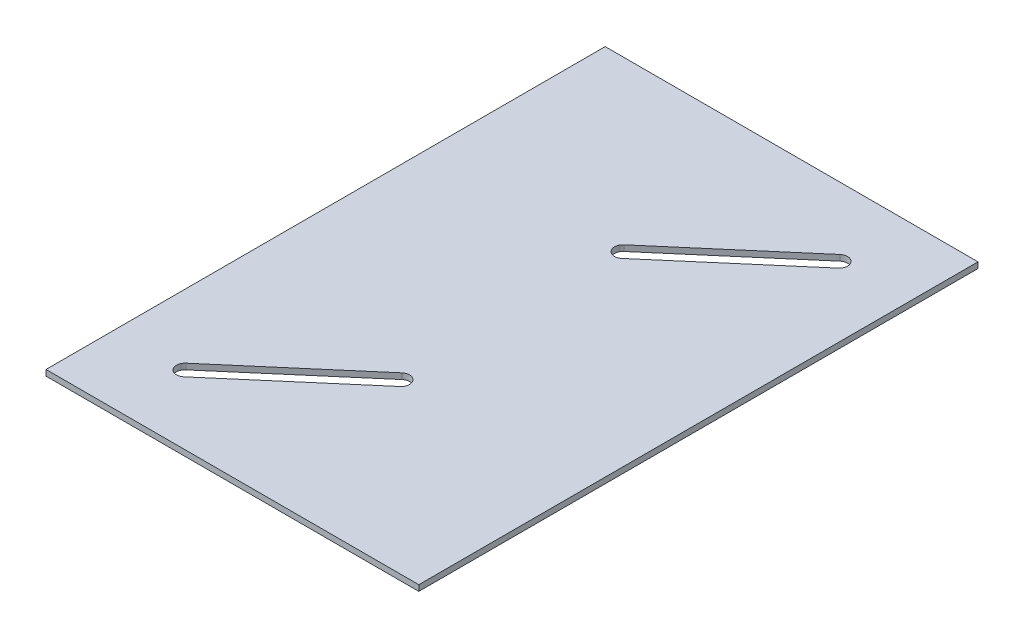
from build123d import *

# Parameters (mm, degrees)
SKETCH1_W           = 101.6
SKETCH1_H           = 127
BOSS_EXTRUDE1_DEPTH = 1.5875
CUT_EXTRUDE1_DEPTH  = 82.335171705
SKETCH4_W           = 101.6
SKETCH4_H           = 12.7
BOSS_EXTRUDE2_DEPTH = 1.5875
SKETCH6_R           = 0.0127
CUT_EXTRUDE2_DEPTH  = 92.594760528


with BuildPart() as part:
    # Sketch1 → Boss-Extrude1 (new body)
    with BuildSketch(Plane(origin=(0, 0, 0), x_dir=(1, 0, 0), z_dir=(0, 1, 0))):
        Rectangle(SKETCH1_W, SKETCH1_H)
    extrude(amount=BOSS_EXTRUDE1_DEPTH)

    # Sketch3 → Cut-Extrude1 (cut, through all)
    with BuildSketch(Plane(origin=(0, 1.5875, 0), x_dir=(1, 0, 0), z_dir=(0, 1, 0))):
        with BuildLine():
            Line((-1.486564617, 31.962640907), (30.263435383, 59.140640907))
            ThreePointArc((30.263435383, 59.140640907), (33.486640907, 58.890564617), (33.236564617, 55.667359093))
            Line((33.236564617, 55.667359093), (1.486564617, 28.489359093))
            ThreePointArc((1.486564617, 28.489359093), (-1.736640907, 28.739435383), (-1.486564617, 31.962640907))
        make_face()
        with BuildLine():
            Line((1.486564617, -31.962640907), (-30.263435383, -59.140640907))
            ThreePointArc((-30.263435383, -59.140640907), (-33.486640907, -58.890564617), (-33.236564617, -55.667359093))
            Line((-33.236564617, -55.667359093), (-1.486564617, -28.489359093))
            ThreePointArc((-1.486564617, -28.489359093), (1.736640907, -28.739435383), (1.486564617, -31.962640907))
        make_face()
    extrude(amount=-CUT_EXTRUDE1_DEPTH, mode=Mode.SUBTRACT)

    # Sketch4 → Boss-Extrude2 (add)
    with BuildSketch(Plane(origin=(0, 1.5875, 0), x_dir=(1, 0, 0), z_dir=(0, 1, 0))):
        with Locations((0, 69.85)):
            Rectangle(SKETCH4_W, SKETCH4_H)
        with Locations((0, -69.85)):
            Rectangle(SKETCH4_W, SKETCH4_H)
    extrude(amount=-BOSS_EXTRUDE2_DEPTH)

    # Sketch6 → Cut-Extrude2 (cut, through all)
    with BuildSketch(Plane(origin=(0, 1.5875, 0), x_dir=(1, 0, 0), z_dir=(0, 1, 0))):
        with Locations((-11.43, 68.58)):
            Circle(SKETCH6_R)
        with Locations((11.43, 68.58)):
            Circle(SKETCH6_R)
    extrude(amount=-CUT_EXTRUDE2_DEPTH, mode=Mode.SUBTRACT)


solid = part.part
